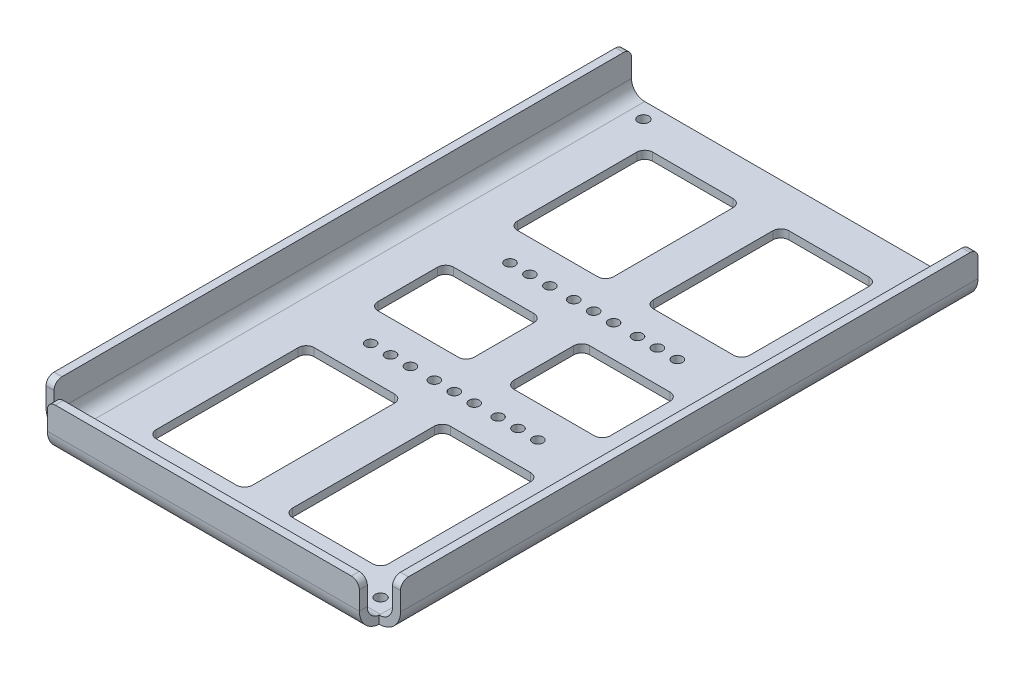
from build123d import *

# Parameters (mm, degrees)
BASE_FLANGE1_DEPTH           = 75
SKETCH5_R                    = 1.3
CUT_EXTRUDE1_DEPTH           = 10
SKETCH6_W                    = 89
SKETCH6_H                    = 5
CUT_EXTRUDE2_DEPTH           = 35
SKETCH9_W                    = 78.34
SKETCH9_H                    = 2
BOSS_EXTRUDE1_DEPTH          = 3
EDGE_FLANGE1_STRIP_W         = 14.66
EDGE_FLANGE1_STRIP_H         = 2
EDGE_FLANGE1_STRIP_CUT_DEPTH = 78.34
EDGE_FLANGE1_DEPTH           = 78.34
FILLET1_R                    = 2
SKETCH13_W                   = 24.17
SKETCH13_H                   = 34
SKETCH13_H_2                 = 19
SKETCH13_H_3                 = 39.67
CUT_EXTRUDE3_DEPTH           = 10
FILLET2_R                    = 2
SKETCH14_R                   = 1.37
CUT_EXTRUDE4_DEPTH           = 10


# Sheet-metal steps are written as plain solids
with BuildPart() as part:
    # Sketch1 → Base-Flange1 (new, symmetric)
    with BuildSketch(Plane.XY):
        with BuildLine():
            Line((-42.5, 10), (-42.5, 3.33))
            ThreePointArc((-42.5, 3.33), (-41.524665581, 0.975334419), (-39.17, 0))
            Line((-39.17, 0), (39.17, 0))
            ThreePointArc((39.17, 0), (41.524665581, 0.975334419), (42.5, 3.33))
            Line((42.5, 3.33), (42.5, 10))
            Line((42.5, 10), (44.5, 10))
            Line((44.5, 10), (44.5, 3.33))
            ThreePointArc((44.5, 3.33), (42.938879144, -0.438879144), (39.17, -2))
            Line((39.17, -2), (-39.17, -2))
            ThreePointArc((-39.17, -2), (-42.938879144, -0.438879144), (-44.5, 3.33))
            Line((-44.5, 3.33), (-44.5, 10))
            Line((-44.5, 10), (-42.5, 10))
        make_face()
    extrude(amount=BASE_FLANGE1_DEPTH, both=True)

    # Sketch5 → Cut-Extrude1 (cut)
    with BuildSketch(Plane(origin=(0, 0, 0), x_dir=(-1, 0, 0), z_dir=(0, 1, 0))):
        with Locations(Location((0, -23, 0), (0, 0, 90))):
            Circle(SKETCH5_R)
        with Locations(Location((16, -23, 0), (0, 0, 90))):
            Circle(SKETCH5_R)
        with Locations(Location((16, 12, 0), (0, 0, 90))):
            Circle(SKETCH5_R)
        with Locations(Location((0, 12, 0), (0, 0, 90))):
            Circle(SKETCH5_R)
        with Locations(Location((-16, 12, 0), (0, 0, 90))):
            Circle(SKETCH5_R)
        with Locations(Location((-16, -23, 0), (0, 0, 90))):
            Circle(SKETCH5_R)
        with Locations(Location((11, 12, 0), (0, 0, 90))):
            Circle(SKETCH5_R)
        with Locations(Location((5, 12, 0), (0, 0, 90))):
            Circle(SKETCH5_R)
        with Locations(Location((-5, 12, 0), (0, 0, 90))):
            Circle(SKETCH5_R)
        with Locations(Location((-11, 12, 0), (0, 0, 90))):
            Circle(SKETCH5_R)
        with Locations(Location((11, -23, 0), (0, 0, 90))):
            Circle(SKETCH5_R)
        with Locations(Location((5, -23, 0), (0, 0, 90))):
            Circle(SKETCH5_R)
        with Locations(Location((-5, -23, 0), (0, 0, 90))):
            Circle(SKETCH5_R)
        with Locations(Location((-11, -23, 0), (0, 0, 90))):
            Circle(SKETCH5_R)
        with Locations(Location((21, 12, 0), (0, 0, 90))):
            Circle(SKETCH5_R)
        with Locations(Location((21, -23, 0), (0, 0, 90))):
            Circle(SKETCH5_R)
        with Locations(Location((-21, -23, 0), (0, 0, 90))):
            Circle(SKETCH5_R)
        with Locations(Location((-21, 12, 0), (0, 0, 90))):
            Circle(SKETCH5_R)
    extrude(amount=-CUT_EXTRUDE1_DEPTH, mode=Mode.SUBTRACT)

    # Sketch6 → Cut-Extrude2 (cut)
    with BuildSketch(Plane.XZ.offset(2)):
        with Locations((0, 72.5)):
            Rectangle(SKETCH6_W, SKETCH6_H)
    extrude(amount=-CUT_EXTRUDE2_DEPTH, mode=Mode.SUBTRACT)

    # Sketch9 → Boss-Extrude1 (add)
    with BuildSketch(Plane.XY.offset(70)):
        with Locations((0, -1)):
            Rectangle(SKETCH9_W, SKETCH9_H)
    extrude(amount=BOSS_EXTRUDE1_DEPTH)

    # Edge-Flange1 strip (across the edge) → Edge-Flange1 strip cut (cut)
    with BuildSketch(Plane(origin=(-39.17, 0, 73), x_dir=(0, 0, -1), z_dir=(1, 0, 0))):
        with Locations((-4, -1)):
            Rectangle(EDGE_FLANGE1_STRIP_W, EDGE_FLANGE1_STRIP_H)
    extrude(amount=EDGE_FLANGE1_STRIP_CUT_DEPTH, mode=Mode.SUBTRACT)

    # Edge-Flange1 section (across the edge) → Edge-Flange1 (add)
    with BuildSketch(Plane(origin=(-39.17, 0, 73), x_dir=(0, 0, -1), z_dir=(1, 0, 0))):
        with BuildLine():
            Line((-2, 3.33), (-2, 10))
            Line((-2, 10), (0, 10))
            Line((0, 10), (0, 3.33))
            ThreePointArc((0, 3.33), (0.975334419, 0.975334419), (3.33, 0))
            Line((3.33, 0), (3.33, -2))
            ThreePointArc((3.33, -2), (-0.438879144, -0.438879144), (-2, 3.33))
        make_face()
    extrude(amount=EDGE_FLANGE1_DEPTH)

    # Fillet1
    fillet1_edges = [part.edges().sort_by_distance(p)[0] for p in [
        (-43.5, 10, -75),
        (43.5, 10, -75),
        (43.5, 10, 70),
        (-43.5, 10, 70),
        (-39.17, 10, 74),
        (39.17, 10, 74),
    ]]
    fillet(fillet1_edges, radius=FILLET1_R)

    # Sketch13 → Cut-Extrude3 (cut)
    with BuildSketch(Plane(origin=(0, 0, 0), x_dir=(1, 0, 0), z_dir=(0, 1, 0))):
        with Locations((-17.085, 48)):
            Rectangle(SKETCH13_W, SKETCH13_H)
        with Locations((17.085, 48)):
            Rectangle(SKETCH13_W, SKETCH13_H)
        with Locations((-17.085, 5.5)):
            Rectangle(SKETCH13_W, SKETCH13_H_2)
        with Locations((17.085, 5.5)):
            Rectangle(SKETCH13_W, SKETCH13_H_2)
        with Locations((-17.085, -39.835)):
            Rectangle(SKETCH13_W, SKETCH13_H_3)
        with Locations((17.085, -39.835)):
            Rectangle(SKETCH13_W, SKETCH13_H_3)
    extrude(amount=-CUT_EXTRUDE3_DEPTH, mode=Mode.SUBTRACT)

    # Fillet2
    fillet2_edges = [part.edges().sort_by_distance(p)[0] for p in [
        (-29.17, -1, -31),
        (-29.17, -1, -65),
        (-5, -1, -65),
        (-5, -1, -31),
        (5, -1, -31),
        (5, -1, -65),
        (29.17, -1, -65),
        (29.17, -1, -31),
        (-29.17, -1, 4),
        (-29.17, -1, -15),
        (-5, -1, -15),
        (-5, -1, 4),
        (5, -1, 4),
        (5, -1, -15),
        (29.17, -1, -15),
        (29.17, -1, 4),
        (-29.17, -1, 59.67),
        (-29.17, -1, 20),
        (-5, -1, 20),
        (-5, -1, 59.67),
        (5, -1, 59.67),
        (5, -1, 20),
        (29.17, -1, 20),
        (29.17, -1, 59.67),
    ]]
    fillet(fillet2_edges, radius=FILLET2_R)

    # Sketch14 → Cut-Extrude4 (cut)
    with BuildSketch(Plane(origin=(0, 0, 0), x_dir=(1, 0, 0), z_dir=(0, 1, 0))):
        with Locations(Location((-35.5, 71, 0), (0, 0, 270))):
            Circle(SKETCH14_R)
        with Locations(Location((35.5, 71, 0), (0, 0, 270))):
            Circle(SKETCH14_R)
        with Locations(Location((35.5, -66, 0), (0, 0, 270))):
            Circle(SKETCH14_R)
        with Locations(Location((-35.5, -66, 0), (0, 0, 270))):
            Circle(SKETCH14_R)
    extrude(amount=-CUT_EXTRUDE4_DEPTH, mode=Mode.SUBTRACT)


solid = part.part
